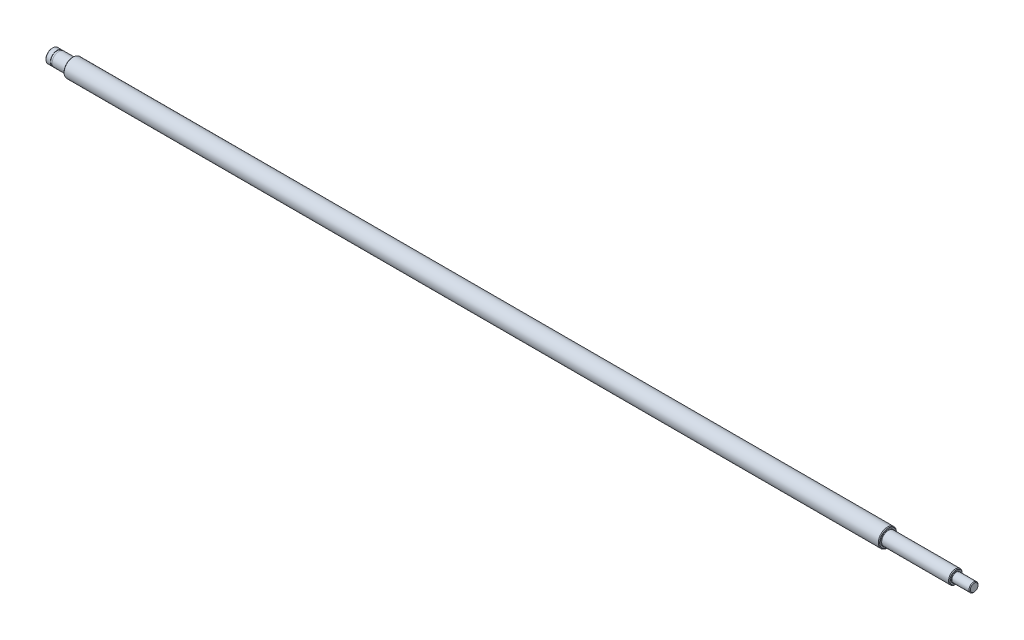
from build123d import *


with BuildPart() as part:
    # 草图1 → 旋转1 (revolve)
    with BuildSketch(Plane(origin=(0, 0, 0), x_dir=(-1, 0, 0), z_dir=(0, 0, -1))):
        with BuildLine():
            Line((-407, 1.7), (-407, 0))
            Line((-407, 0), (0, 0))
            Line((0, 0), (0, 2.7))
            Line((0, 2.7), (-0.3, 3))
            Line((-0.3, 3), (-2.2, 3))
            Line((-2.2, 3), (-2.2, 2.85))
            Line((-2.2, 2.85), (-3, 2.85))
            Line((-3, 2.85), (-3, 3))
            Line((-3, 3), (-8.8, 3))
            ThreePointArc((-8.8, 3), (-8.941421356, 3.058578644), (-9, 3.2))
            Line((-9, 3.2), (-9, 3.7))
            Line((-9, 3.7), (-9.3, 4))
            Line((-9.3, 4), (-368.7, 4))
            Line((-368.7, 4), (-369, 3.7))
            Line((-369, 3.7), (-369, 3.2))
            ThreePointArc((-369, 3.2), (-369.058578644, 3.058578644), (-369.2, 3))
            Line((-369.2, 3), (-398.7, 3))
            Line((-398.7, 3), (-399, 2.7))
            Line((-399, 2.7), (-399, 2.2))
            ThreePointArc((-399, 2.2), (-399.058578644, 2.058578644), (-399.2, 2))
            Line((-399.2, 2), (-406.7, 2))
            Line((-406.7, 2), (-407, 1.7))
        make_face()
    revolve(axis=Axis((407, 0, 0), (-1, 0, 0)))


solid = part.part
